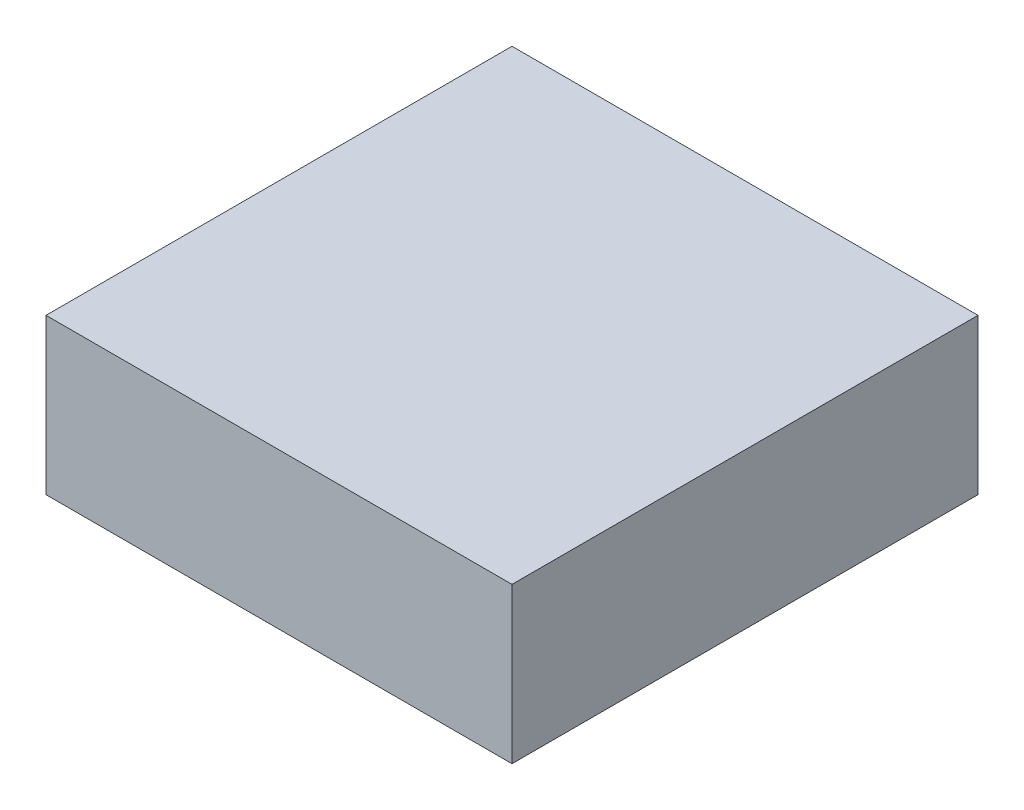
from build123d import *

# Parameters (mm, degrees)
SCHIZZO1_W                   = 3
SCHIZZO1_H                   = 3
ESTRUSIONE_ESTRUSIONE1_DEPTH = 1


with BuildPart() as part:
    # Schizzo1 → Estrusione-Estrusione1 (new body)
    with BuildSketch(Plane(origin=(0, 0, 0), x_dir=(1, 0, 0), z_dir=(0, 1, 0))):
        with Locations((-5.11081678, 9.134792212)):
            Rectangle(SCHIZZO1_W, SCHIZZO1_H)
    extrude(amount=ESTRUSIONE_ESTRUSIONE1_DEPTH)


solid = part.part
